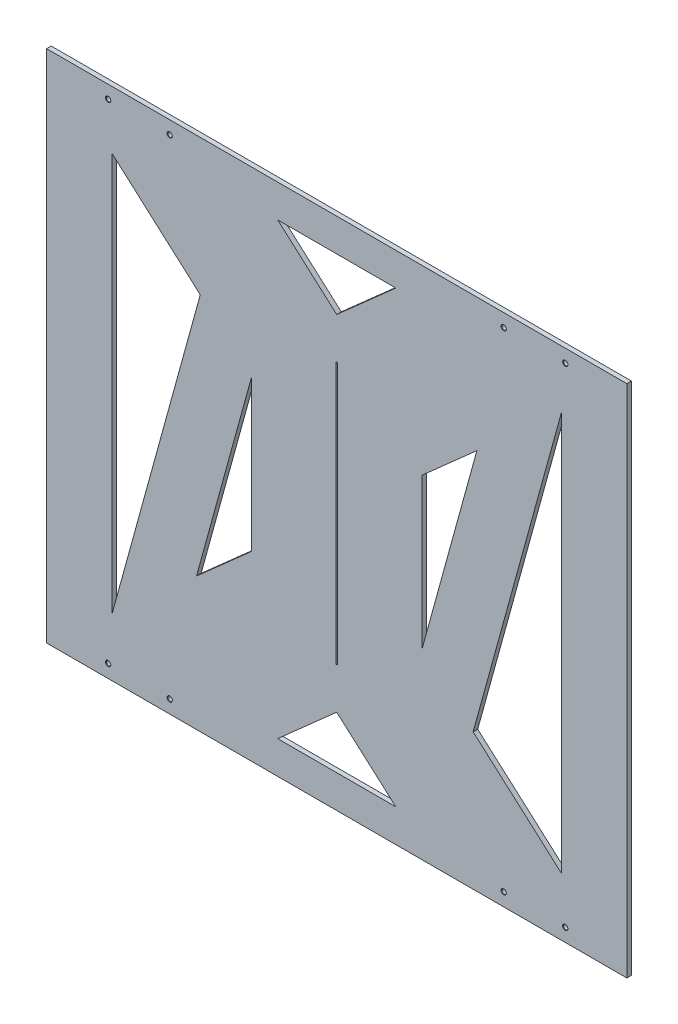
from build123d import *

# Parameters (mm, degrees)
SCHIZZO1_W                      = 886
SCHIZZO1_H                      = 786
ESTRUSIONE_ESTRUSIONE1_DEPTH    = 7
FORO_FILETTATO_M8_1_D           = 6.8
FORO_FILETTATO_M8_1_DEPTH       = 22.25
FORO_FILETTATO_M8_1_CSINK_D     = 8.05
FORO_FILETTATO_M8_1_CSINK_ANGLE = 90
FORO_FILETTATO_M8_1_TIP         = 2.042926105
SCHIZZO11_W                     = 2
SCHIZZO11_H                     = 400
TAGLIO_ESTRUSIONE1_DEPTH        = 5
TAGLIO_ESTRUSIONE2_DEPTH        = 593.238972037


with BuildPart() as part:
    # Schizzo1 → Estrusione-Estrusione1 (new body)
    with BuildSketch(Plane.XY):
        Rectangle(SCHIZZO1_W, SCHIZZO1_H)
    extrude(amount=ESTRUSIONE_ESTRUSIONE1_DEPTH)

    # Foro filettato M8-1
    with Locations(Plane.XY.offset(7)):
        with Locations((-349, 373), (-255, 373), (255, 373), (349, 373), (-349, -373), (-255, -373), (349, -373), (255, -373)):
            CounterSinkHole(FORO_FILETTATO_M8_1_D / 2, FORO_FILETTATO_M8_1_CSINK_D / 2, depth=FORO_FILETTATO_M8_1_DEPTH, counter_sink_angle=FORO_FILETTATO_M8_1_CSINK_ANGLE)
            with Locations((0, 0, -(FORO_FILETTATO_M8_1_DEPTH + FORO_FILETTATO_M8_1_TIP / 2))):  # 118° drill point
                Cone(0, FORO_FILETTATO_M8_1_D / 2, FORO_FILETTATO_M8_1_TIP, mode=Mode.SUBTRACT)

    # Schizzo11 → Taglio-Estrusione1 (cut)
    with BuildSketch(Plane.XY.offset(7)):
        Rectangle(SCHIZZO11_W, SCHIZZO11_H)
    extrude(amount=-TAGLIO_ESTRUSIONE1_DEPTH, mode=Mode.SUBTRACT)

    # Schizzo12 → Taglio-Estrusione2 (cut, through all)
    with BuildSketch(Plane.XY.offset(7)):
        Polygon((-343, 304.286681716), (-343, -304.286681716), (-208.348998865, 184.833310506), align=None)
        Polygon((-130, 115.32731377), (-214.01590717, -189.860612907), (-130, -115.32731377), align=None)
        Polygon((343, -304.286681716), (208.348998865, -184.833310506), (343, 304.286681716), align=None)
        Polygon((130, -115.32731377), (214.01590717, 189.860612907), (130, 115.32731377), align=None)
        Polygon((-90.178117048, 343), (90.178117048, 343), (0, 263), align=None)
        Polygon((-90.178117048, -343), (90.178117048, -343), (0, -263), align=None)
    extrude(amount=-TAGLIO_ESTRUSIONE2_DEPTH, mode=Mode.SUBTRACT)


solid = part.part
